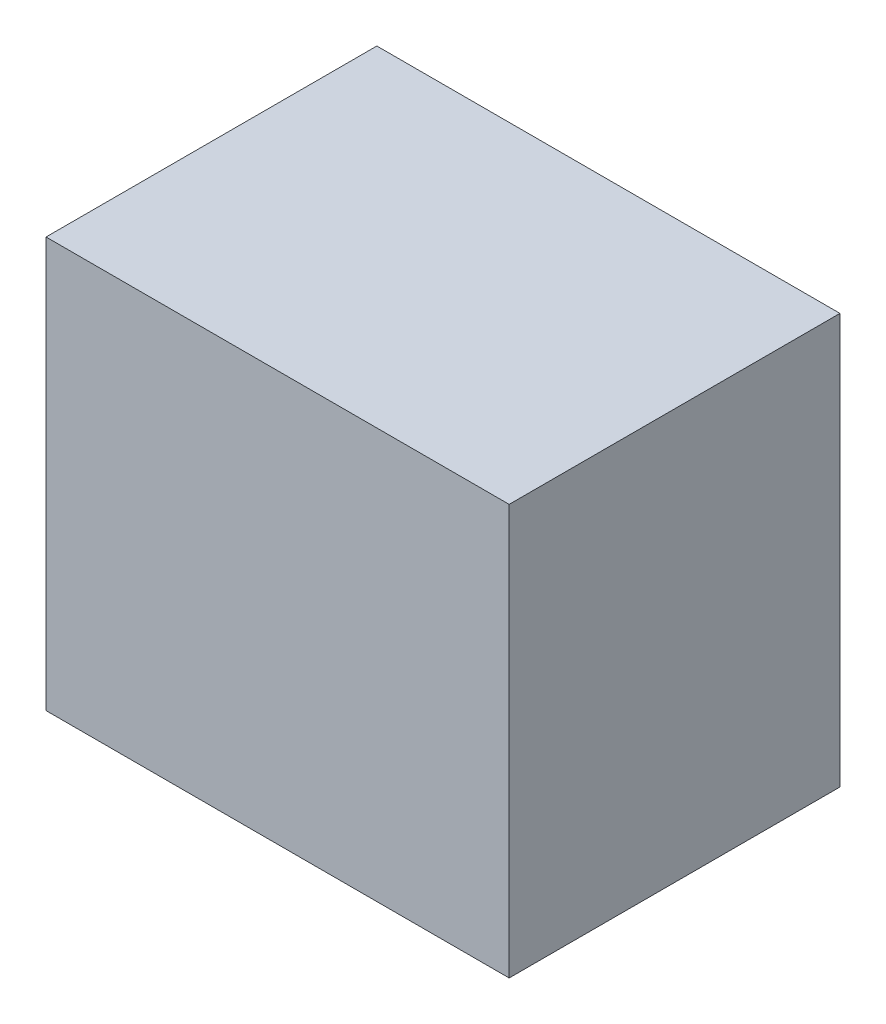
from build123d import *

# Parameters (mm, degrees)
SKETCH_2_W      = 350
SKETCH_2_H      = 250
EXTRUDE_1_DEPTH = 310


with BuildPart() as part:
    # Эскиз2 → Бобышка-Вытянуть1 (new body)
    with BuildSketch(Plane(origin=(0, 0, 0), x_dir=(1, 0, 0), z_dir=(0, 1, 0))):
        with Locations((175, 125)):
            Rectangle(SKETCH_2_W, SKETCH_2_H)
    extrude(amount=EXTRUDE_1_DEPTH)


solid = part.part
